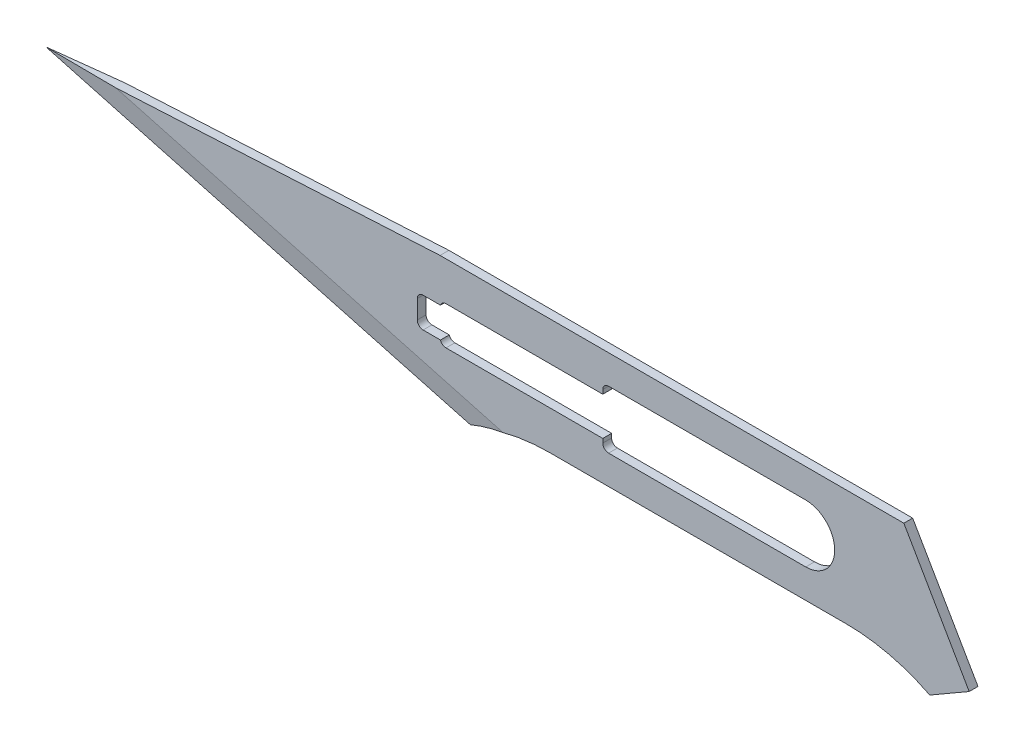
from build123d import *

# Parameters (mm, degrees)
BOSS_EXTRU_1_DEPTH           = 0.19
ENL_V_MAT_EXTRU_1_DEPTH      = 24.560167769
CONG_1_R                     = 0.25
ENL_V_MAT_EXTRU_2_DEPTH      = 21.94767488
ENL_V_MAT_EXTRU_2_DEPTH_BACK = 21.94767488


with BuildPart() as part:
    # Esquisse1 → Boss.-Extru.1 (new, symmetric)
    with BuildSketch(Plane.XY):
        with BuildLine():
            Line((-17.183394089, -0.900543525), (0, 0))
            Line((0, 0), (20, 0))
            Line((20, 0), (22.816605911, -4.878504542))
            Line((22.816605911, -4.878504542), (21.116605911, -5.86))
            ThreePointArc((21.116605911, -5.86), (19.362950472, -5.217969417), (17.508226773, -5))
            Line((17.508226773, -5), (4.724985048, -5))
            ThreePointArc((4.724985048, -5), (2.870261349, -5.217969417), (1.116605911, -5.86))
            Line((1.116605911, -5.86), (-17.183394089, -0.900543525))
        make_face()
    extrude(amount=BOSS_EXTRU_1_DEPTH, both=True)

    # Esquisse2 → Enlèv. mat.-Extru.1 (cut, through all)
    with BuildSketch(Plane.XY.offset(0.19)):
        with BuildLine():
            Line((-0.983394089, -1.85), (0.016605911, -1.85))
            Line((0.016605911, -1.85), (0.016605911, -1.675))
            Line((0.016605911, -1.675), (7.016605911, -1.675))
            Line((7.016605911, -1.675), (7.016605911, -1.25))
            Line((7.016605911, -1.25), (15.766605911, -1.25))
            ThreePointArc((15.766605911, -1.25), (17.016605911, -2.5), (15.766605911, -3.75))
            Line((15.766605911, -3.75), (7.016605911, -3.75))
            Line((7.016605911, -3.75), (7.016605911, -3.325))
            Line((7.016605911, -3.325), (0.016605911, -3.325))
            Line((0.016605911, -3.325), (0.016605911, -3.15))
            Line((0.016605911, -3.15), (-0.983394089, -3.15))
            Line((-0.983394089, -3.15), (-0.983394089, -1.85))
        make_face()
    extrude(amount=-ENL_V_MAT_EXTRU_1_DEPTH, mode=Mode.SUBTRACT)

    # Congé1
    # the kernel refuses this fillet: 0.25 mm, written as the material it adds along each edge
    with BuildSketch(Plane(origin=(7.016605911, -3.75, 0.19), x_dir=(0, 1, 0), z_dir=(0, 0, -1))) as cong_1_piece_1:
        with BuildLine():
            CenterArc((CONG_1_R, CONG_1_R), CONG_1_R, 180, 90)
            Line((0, CONG_1_R), (-CONG_1_R * 0.02, CONG_1_R))
            Line((-CONG_1_R * 0.02, CONG_1_R), (-CONG_1_R * 0.02, -CONG_1_R * 0.02))
            Line((-CONG_1_R * 0.02, -CONG_1_R * 0.02), (CONG_1_R, -CONG_1_R * 0.02))
            Line((CONG_1_R, -CONG_1_R * 0.02), (CONG_1_R, 0))
        make_face()
    extrude(amount=0.38)
    with BuildSketch(Plane(origin=(7.016605911, -1.25, 0.19), x_dir=(0, -1, 0), z_dir=(0, 0, -1)), Plane(origin=(-0.983394089, -3.15, 0.19), x_dir=(1, 0, 0), z_dir=(0, 0, -1)), Plane(origin=(-0.983394089, -1.85, 0.19), x_dir=(0, -1, 0), z_dir=(0, 0, -1))) as cong_1_piece_2:
        with BuildLine():
            CenterArc((CONG_1_R, -CONG_1_R), CONG_1_R, 90, 90)
            Line((0, -CONG_1_R), (-CONG_1_R * 0.02, -CONG_1_R))
            Line((-CONG_1_R * 0.02, -CONG_1_R), (-CONG_1_R * 0.02, CONG_1_R * 0.02))
            Line((-CONG_1_R * 0.02, CONG_1_R * 0.02), (CONG_1_R, CONG_1_R * 0.02))
            Line((CONG_1_R, CONG_1_R * 0.02), (CONG_1_R, 0))
        make_face()
    extrude(amount=0.38)
    with BuildSketch(Plane(origin=(0.016605911, -3.325, 0.19), x_dir=(1, 0, 0), z_dir=(0, 0, -1))) as cong_1_piece_3:
        with BuildLine():
            CenterArc((0.2384848, -0.25), CONG_1_R, 90, 72.542396876)
            Line((0, -0.175), (-0.004769696, -0.1735))
            ThreePointArc((-0.004769696, -0.1735), (-0.005, -0.0875), (-0.005, 0))
            Line((-0.005, 0), (0, 0.005))
            Line((0, 0.005), (0.2384848, 0.005))
            Line((0.2384848, 0.005), (0.2384848, 0))
        make_face()
    extrude(amount=0.38)
    with BuildSketch(Plane(origin=(0.016605911, -1.675, 0.19), x_dir=(0, -1, 0), z_dir=(0, 0, -1))) as cong_1_piece_4:
        with BuildLine():
            CenterArc((0.25, -0.2384848), CONG_1_R, 107.457603124, 72.542396876)
            Line((0, -0.2384848), (-0.005, -0.2384848))
            Line((-0.005, -0.2384848), (-0.005, 0))
            Line((-0.005, 0), (0, 0.005))
            ThreePointArc((0, 0.005), (0.0875, 0.005), (0.1735, 0.004769696))
            Line((0.1735, 0.004769696), (0.175, 0))
        make_face()
    extrude(amount=0.38)

    # Esquisse3 → Enlèv. mat.-Extru.2 (cut, two sides: drawn at the far end of the back side and taken through both)
    with BuildSketch(Plane(origin=(2.519658127, -0.682848897, 0), x_dir=(0, 0, 1), z_dir=(-0.9651836866427717, 0.26157303194073345, 0)).offset(-ENL_V_MAT_EXTRU_2_DEPTH_BACK)):
        Polygon((0, -5.36390241), (0.19, -4.36390241), (0.19, -5.53890241), (-0.19, -5.53890241), (-0.19, -4.36390241), align=None)
    extrude(amount=ENL_V_MAT_EXTRU_2_DEPTH + ENL_V_MAT_EXTRU_2_DEPTH_BACK, mode=Mode.SUBTRACT)


solid = part.part
